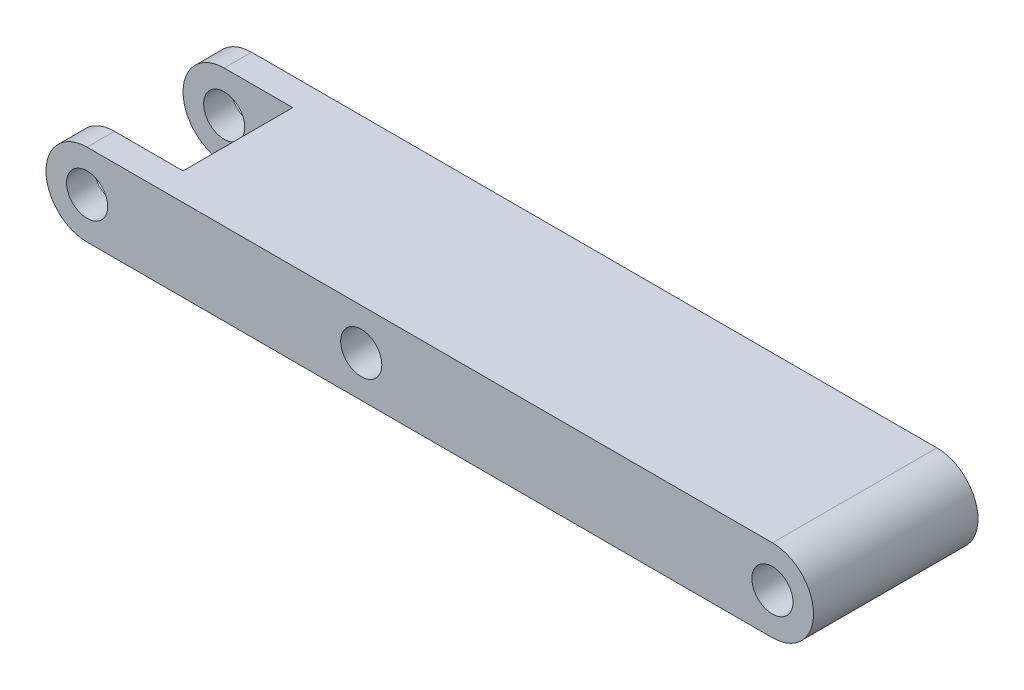
from build123d import *

# Parameters (mm, degrees)
SKETCH1_R           = 1.5
BOSS_EXTRUDE1_DEPTH = 12
SKETCH3_W           = 15.263515406
SKETCH3_H           = 8
CUT_EXTRUDE1_DEPTH  = 10


with BuildPart() as part:
    # Sketch1 → Boss-Extrude1 (new body)
    with BuildSketch(Plane.XY):
        with BuildLine():
            Line((-25, 3), (25, 3))
            ThreePointArc((25, 3), (28, 0), (25, -3))
            Line((25, -3), (-25, -3))
            ThreePointArc((-25, -3), (-28, 0), (-25, 3))
        make_face()
        with Locations((-25, 0)):
            Circle(SKETCH1_R, mode=Mode.SUBTRACT)
        with Locations((25, 0)):
            Circle(SKETCH1_R, mode=Mode.SUBTRACT)
        with Locations((-5, 0)):
            Circle(SKETCH1_R, mode=Mode.SUBTRACT)
    extrude(amount=BOSS_EXTRUDE1_DEPTH)

    # Sketch3 → Cut-Extrude1 (cut)
    with BuildSketch(Plane(origin=(0, 3, 0), x_dir=(1, 0, 0), z_dir=(0, 1, 0))):
        with Locations((-27.631757703, -6)):
            Rectangle(SKETCH3_W, SKETCH3_H)
    extrude(amount=-CUT_EXTRUDE1_DEPTH, mode=Mode.SUBTRACT)


solid = part.part
